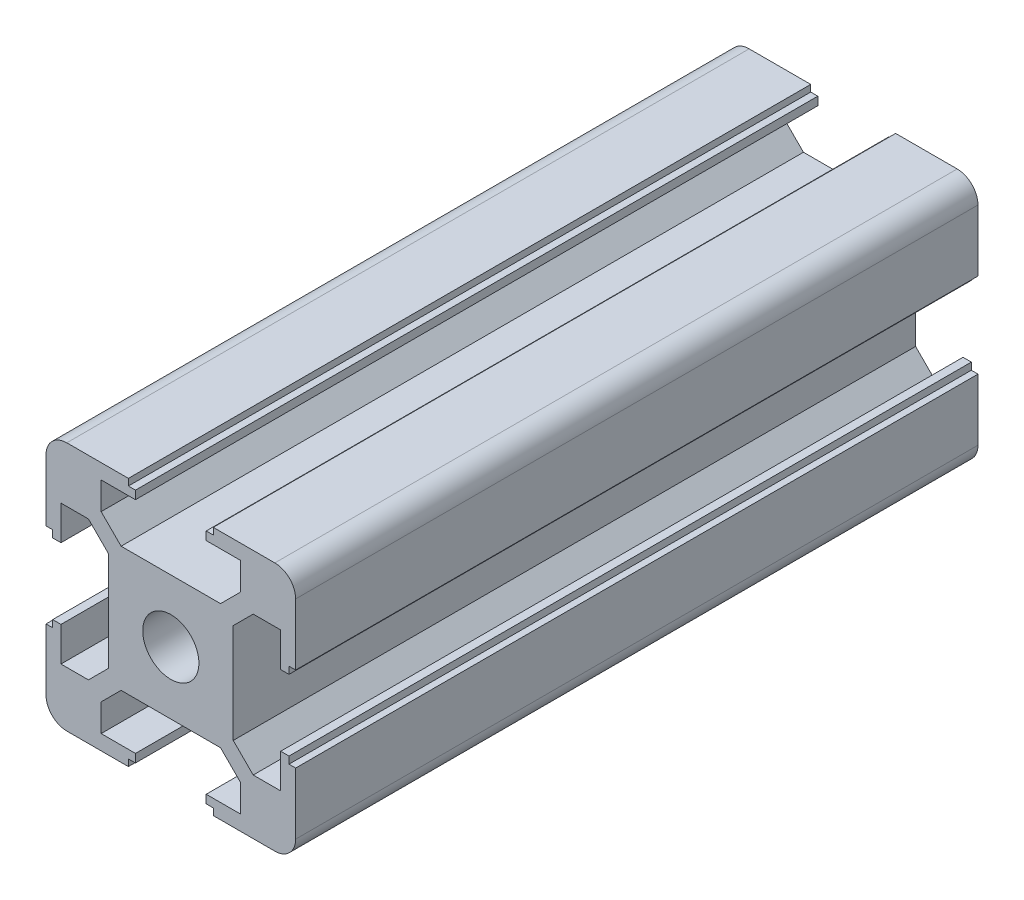
from build123d import *

# Parameters (mm, degrees)
SKETCH1_W                = 30
SKETCH1_H                = 30
BOSS_EXTRUDE1_DEPTH      = 41
SKETCH2_R                = 3.375
CUT_EXTRUDE1_DEPTH       = 85.699468711
FILLET1_R                = 2.5
CUT_EXTRUDE2_DEPTH       = 85.699468711
CIRPATTERN1_COPY_1_DEPTH = 85.699468711
CIRPATTERN1_COPY_2_DEPTH = 85.699468711
CIRPATTERN1_COPY_3_DEPTH = 85.699468711
CIRPATTERN1_COPY_4_DEPTH = 85.699468711
CIRPATTERN1_COPY_5_DEPTH = 85.699468711
CIRPATTERN1_COPY_6_DEPTH = 85.699468711


with BuildPart() as part:
    # Sketch1 → Boss-Extrude1 (new, symmetric)
    with BuildSketch(Plane.XY):
        Rectangle(SKETCH1_W, SKETCH1_H)
    extrude(amount=BOSS_EXTRUDE1_DEPTH, both=True)

    # Sketch2 → Cut-Extrude1 (cut, through all)
    with BuildSketch(Plane.XY.offset(41)):
        Circle(SKETCH2_R)
    extrude(amount=-CUT_EXTRUDE1_DEPTH, mode=Mode.SUBTRACT)

    # Fillet1
    fillet1_edges = [part.edges().sort_by_distance(p)[0] for p in [
        (15, -15, 0),
        (-15, -15, 0),
        (15, 15, 0),
        (-15, 15, 0),
    ]]
    fillet(fillet1_edges, radius=FILLET1_R)

    # Sketch3 → Cut-Extrude2 (cut, through all)
    with BuildSketch(Plane.XY.offset(41)):
        Polygon((0, 15), (-5.1, 15), (-5.1, 14.2), (-4.25, 14.2), (-4.25, 13.2), (-8.375, 13.2), (-8.375, 9.9), (-5.975, 7.5), (0, 7.5), align=None)
    cut_extrude2 = extrude(amount=-CUT_EXTRUDE2_DEPTH, mode=Mode.SUBTRACT)

    # Mirror1: Cut-Extrude2 across plane
    add(cut_extrude2.mirror(Plane(origin=(0, 0, 0), x_dir=(0, 0, 1), z_dir=(1, 0, 0))), mode=Mode.SUBTRACT)

    # CirPattern1 copy 1 sketch → CirPattern1 copy 1 (cut, through all)
    with BuildSketch(Plane(origin=(0, 0, 41), x_dir=(0, -1, 0), z_dir=(0, 0, 1))):
        Polygon((0, -15), (-5.1, -15), (-5.1, -14.2), (-4.25, -14.2), (-4.25, -13.2), (-8.375, -13.2), (-8.375, -9.9), (-5.975, -7.5), (0, -7.5), align=None)
    extrude(amount=-CIRPATTERN1_COPY_1_DEPTH, mode=Mode.SUBTRACT)

    # CirPattern1 copy 2 sketch → CirPattern1 copy 2 (cut, through all)
    with BuildSketch(Plane.XY.offset(41)):
        Polygon((0, -15), (-5.1, -15), (-5.1, -14.2), (-4.25, -14.2), (-4.25, -13.2), (-8.375, -13.2), (-8.375, -9.9), (-5.975, -7.5), (0, -7.5), align=None)
    extrude(amount=-CIRPATTERN1_COPY_2_DEPTH, mode=Mode.SUBTRACT)

    # CirPattern1 copy 3 sketch → CirPattern1 copy 3 (cut, through all)
    with BuildSketch(Plane(origin=(0, 0, 41), x_dir=(0, 1, 0), z_dir=(0, 0, 1))):
        Polygon((0, -15), (-5.1, -15), (-5.1, -14.2), (-4.25, -14.2), (-4.25, -13.2), (-8.375, -13.2), (-8.375, -9.9), (-5.975, -7.5), (0, -7.5), align=None)
    extrude(amount=-CIRPATTERN1_COPY_3_DEPTH, mode=Mode.SUBTRACT)

    # CirPattern1 copy 4 sketch → CirPattern1 copy 4 (cut, through all)
    with BuildSketch(Plane(origin=(0, 0, 41), x_dir=(0, 1, 0), z_dir=(0, 0, 1))):
        Polygon((0, 15), (-5.1, 15), (-5.1, 14.2), (-4.25, 14.2), (-4.25, 13.2), (-8.375, 13.2), (-8.375, 9.9), (-5.975, 7.5), (0, 7.5), align=None)
    extrude(amount=-CIRPATTERN1_COPY_4_DEPTH, mode=Mode.SUBTRACT)

    # CirPattern1 copy 5 sketch → CirPattern1 copy 5 (cut, through all)
    with BuildSketch(Plane(origin=(0, 0, 41), x_dir=(-1, 0, 0), z_dir=(0, 0, 1))):
        Polygon((0, 15), (-5.1, 15), (-5.1, 14.2), (-4.25, 14.2), (-4.25, 13.2), (-8.375, 13.2), (-8.375, 9.9), (-5.975, 7.5), (0, 7.5), align=None)
    extrude(amount=-CIRPATTERN1_COPY_5_DEPTH, mode=Mode.SUBTRACT)

    # CirPattern1 copy 6 sketch → CirPattern1 copy 6 (cut, through all)
    with BuildSketch(Plane(origin=(0, 0, 41), x_dir=(0, -1, 0), z_dir=(0, 0, 1))):
        Polygon((0, 15), (-5.1, 15), (-5.1, 14.2), (-4.25, 14.2), (-4.25, 13.2), (-8.375, 13.2), (-8.375, 9.9), (-5.975, 7.5), (0, 7.5), align=None)
    extrude(amount=-CIRPATTERN1_COPY_6_DEPTH, mode=Mode.SUBTRACT)


solid = part.part
